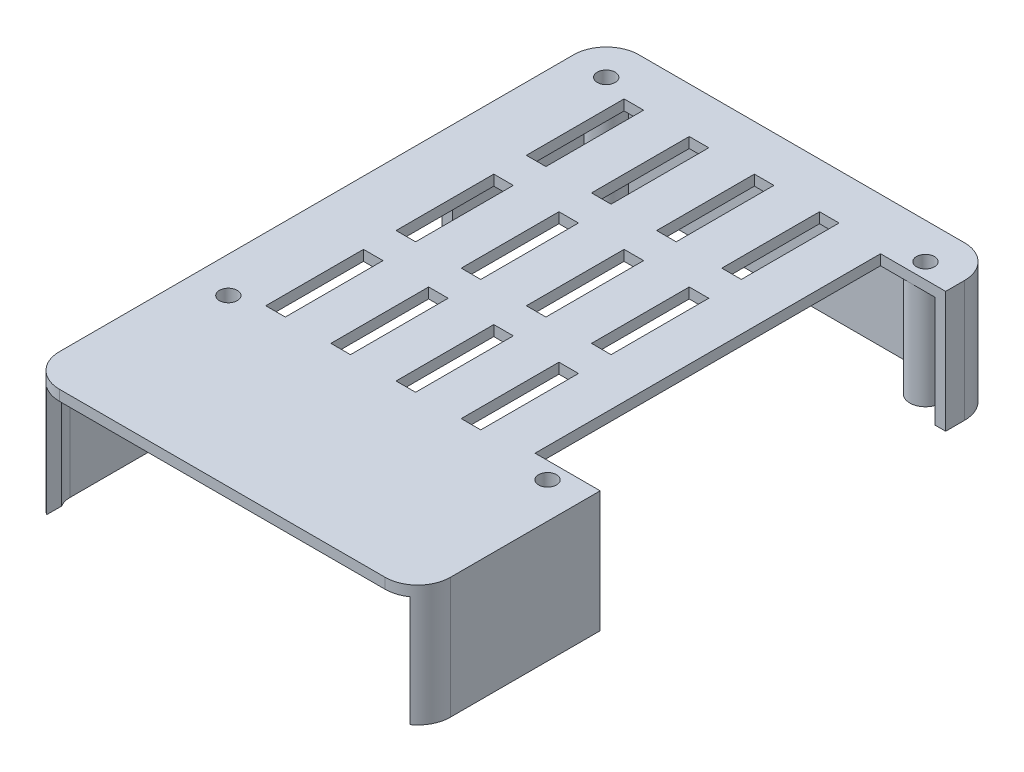
from build123d import *

# Parameters (mm, degrees)
SKETCH1_R           = 1.375
BOSS_EXTRUDE1_DEPTH = 1.6
BOSS_EXTRUDE2_START = -17
BOSS_EXTRUDE2_DEPTH = 17
BOSS_EXTRUDE3_START = -17.6
SKETCH2_R           = 2.4
SKETCH2_R_2         = 1.375
BOSS_EXTRUDE3_DEPTH = 17.6
SKETCH3_W           = 36.288172123
SKETCH3_H           = 9.00941151
CUT_EXTRUDE1_DEPTH  = 10
SKETCH5_W           = 16.770268593
SKETCH5_H           = 4.911067329
CUT_EXTRUDE2_DEPTH  = 10
SKETCH7_W           = 55
SKETCH7_H           = 17
CUT_EXTRUDE3_DEPTH  = 10
SKETCH9_W           = 3
SKETCH9_H           = 15
CUT_EXTRUDE4_DEPTH  = 10
MOVE_FACE1_BY       = 0.4
MOVE_FACE1_2_BY     = 0.4
MOVE_FACE1_3_BY     = 0.4
MOVE_FACE1_4_BY     = 0.4
MOVE_FACE1_5_BY     = 0.4
MOVE_FACE1_6_BY     = 0.4
MOVE_FACE1_7_BY     = 0.4
MOVE_FACE1_8_BY     = 0.4
MOVE_FACE1_9_BY     = 0.4
MOVE_FACE1_10_BY    = 0.4


with BuildPart() as part:
    # Sketch1 → Boss-Extrude1 (new body)
    with BuildSketch(Plane(origin=(0, 0, 0), x_dir=(1, 0, 0), z_dir=(0, 1, 0))):
        with BuildLine():
            Line((43.875879735, -16.202520779), (33.875879735, -16.202520779))
            Line((33.875879735, -16.202520779), (33.875879735, 36.821646567))
            Line((33.875879735, 36.821646567), (43.875879735, 36.821646567))
            Line((43.875879735, 36.821646567), (43.875879735, 39.72781091))
            ThreePointArc((43.875879735, 39.72781091), (42.411413641, 43.263344816), (38.875879735, 44.72781091))
            Line((38.875879735, 44.72781091), (-11.124120265, 44.72781091))
            ThreePointArc((-11.124120265, 44.72781091), (-14.65965417, 43.263344816), (-16.124120265, 39.72781091))
            Line((-16.124120265, 39.72781091), (-16.124120265, -39.202520779))
            ThreePointArc((-16.124120265, -39.202520779), (-14.65965417, -42.738054685), (-11.124120265, -44.202520779))
            Line((-11.124120265, -44.202520779), (38.875879735, -44.202520779))
            ThreePointArc((38.875879735, -44.202520779), (42.411413641, -42.738054685), (43.875879735, -39.202520779))
            Line((43.875879735, -39.202520779), (43.875879735, -16.202520779))
        make_face()
        with Locations((-10.624120265, 39.221646567)):
            Circle(SKETCH1_R, mode=Mode.SUBTRACT)
        with Locations((38.375879735, 39.221646567)):
            Circle(SKETCH1_R, mode=Mode.SUBTRACT)
        with Locations((-10.624120265, -18.778353433)):
            Circle(SKETCH1_R, mode=Mode.SUBTRACT)
        with Locations((38.375879735, -18.778353433)):
            Circle(SKETCH1_R, mode=Mode.SUBTRACT)
    extrude(amount=BOSS_EXTRUDE1_DEPTH)

    # Sketch1<3> → Boss-Extrude2 (add)
    with BuildSketch(Plane(origin=(0, 0, 0), x_dir=(1, 0, 0), z_dir=(0, 1, 0)).offset(BOSS_EXTRUDE2_START)):
        with BuildLine():
            ThreePointArc((41.875879735, -39.202520779), (40.997200079, -41.323841123), (38.875879735, -42.202520779))
            Line((38.875879735, -42.202520779), (-11.124120265, -42.202520779))
            ThreePointArc((-11.124120265, -42.202520779), (-13.245440608, -41.323841123), (-14.124120265, -39.202520779))
            Line((-14.124120265, -39.202520779), (-14.124120265, 39.72781091))
            ThreePointArc((-14.124120265, 39.72781091), (-13.245440608, 41.849131254), (-11.124120265, 42.72781091))
            Line((-11.124120265, 42.72781091), (38.875879735, 42.72781091))
            ThreePointArc((38.875879735, 42.72781091), (40.997200079, 41.849131254), (41.875879735, 39.72781091))
            Line((41.875879735, 39.72781091), (41.875879735, 36.821646567))
            Line((41.875879735, 36.821646567), (43.875879735, 36.821646567))
            Line((43.875879735, 36.821646567), (43.875879735, 39.72781091))
            ThreePointArc((43.875879735, 39.72781091), (42.411413641, 43.263344816), (38.875879735, 44.72781091))
            Line((38.875879735, 44.72781091), (-11.124120265, 44.72781091))
            ThreePointArc((-11.124120265, 44.72781091), (-14.65965417, 43.263344816), (-16.124120265, 39.72781091))
            Line((-16.124120265, 39.72781091), (-16.124120265, -39.202520779))
            ThreePointArc((-16.124120265, -39.202520779), (-14.65965417, -42.738054685), (-11.124120265, -44.202520779))
            Line((-11.124120265, -44.202520779), (38.875879735, -44.202520779))
            ThreePointArc((38.875879735, -44.202520779), (42.411413641, -42.738054685), (43.875879735, -39.202520779))
            Line((43.875879735, -39.202520779), (43.875879735, -16.202520779))
            Line((43.875879735, -16.202520779), (41.875879735, -16.202520779))
            Line((41.875879735, -16.202520779), (41.875879735, -39.202520779))
        make_face()
    extrude(amount=BOSS_EXTRUDE2_DEPTH)

    # Sketch2 → Boss-Extrude3 (add)
    # profile 1 of 4: a face of its own
    with BuildSketch(Plane(origin=(0, 1.6, 0), x_dir=(1, 0, 0), z_dir=(0, 1, 0)).offset(BOSS_EXTRUDE3_START)):
        with Locations((38.375879735, 39.221646567)):
            Circle(SKETCH2_R)
        with Locations((38.375879735, 39.221646567)):
            Circle(SKETCH2_R_2, mode=Mode.SUBTRACT)
    # profile 2 of 4: a face of its own
    with BuildSketch(Plane(origin=(0, 1.6, 0), x_dir=(1, 0, 0), z_dir=(0, 1, 0)).offset(BOSS_EXTRUDE3_START)):
        with Locations((38.375879735, -18.778353433)):
            Circle(SKETCH2_R)
        with Locations((38.375879735, -18.778353433)):
            Circle(SKETCH2_R_2, mode=Mode.SUBTRACT)
    # profile 3 of 4: a face of its own
    with BuildSketch(Plane(origin=(0, 1.6, 0), x_dir=(1, 0, 0), z_dir=(0, 1, 0)).offset(BOSS_EXTRUDE3_START)):
        with Locations((-10.624120265, -18.778353433)):
            Circle(SKETCH2_R)
        with Locations((-10.624120265, -18.778353433)):
            Circle(SKETCH2_R_2, mode=Mode.SUBTRACT)
    # profile 4 of 4: a face of its own
    with BuildSketch(Plane(origin=(0, 1.6, 0), x_dir=(1, 0, 0), z_dir=(0, 1, 0)).offset(BOSS_EXTRUDE3_START)):
        with Locations((-10.624120265, 39.221646567)):
            Circle(SKETCH2_R)
        with Locations((-10.624120265, 39.221646567)):
            Circle(SKETCH2_R_2, mode=Mode.SUBTRACT)
    extrude(amount=BOSS_EXTRUDE3_DEPTH)

    # Sketch3 → Cut-Extrude1 (cut)
    with BuildSketch(Plane(origin=(-14.124120265, 0, 0), x_dir=(0, 0, -1), z_dir=(1, 0, 0))):
        with Locations((1.373104953, -12.495294245)):
            Rectangle(SKETCH3_W, SKETCH3_H)
    extrude(amount=-CUT_EXTRUDE1_DEPTH, mode=Mode.SUBTRACT)

    # Sketch5 → Cut-Extrude2 (cut)
    with BuildSketch(Plane.ZY.offset(16.124120265)):
        with Locations((-27.902325311, -14.544466336)):
            Rectangle(SKETCH5_W, SKETCH5_H)
    extrude(amount=-CUT_EXTRUDE2_DEPTH, mode=Mode.SUBTRACT)

    # Sketch7 → Cut-Extrude3 (cut)
    with BuildSketch(Plane.XY.offset(44.202520779)):
        with Locations((13.875879735, -8.5)):
            Rectangle(SKETCH7_W, SKETCH7_H)
    extrude(amount=-CUT_EXTRUDE3_DEPTH, mode=Mode.SUBTRACT)

    # Sketch9 → Cut-Extrude4 (cut)
    with BuildSketch(Plane(origin=(0, 1.6, 0), x_dir=(1, 0, 0), z_dir=(0, 1, 0))):
        with Locations((-4.888394882, 30.22781091)):
            Rectangle(SKETCH9_W, SKETCH9_H)
        with Locations((5.111605118, 30.22781091)):
            Rectangle(SKETCH9_W, SKETCH9_H)
        with Locations((15.111605118, 30.22781091)):
            Rectangle(SKETCH9_W, SKETCH9_H)
        with Locations((25.111605118, 30.22781091)):
            Rectangle(SKETCH9_W, SKETCH9_H)
        with Locations((5.111605118, 10.22781091)):
            Rectangle(SKETCH9_W, SKETCH9_H)
        with Locations((15.111605118, 10.22781091)):
            Rectangle(SKETCH9_W, SKETCH9_H)
        with Locations((25.111605118, 10.22781091)):
            Rectangle(SKETCH9_W, SKETCH9_H)
        with Locations((5.111605118, -9.77218909)):
            Rectangle(SKETCH9_W, SKETCH9_H)
        with Locations((15.111605118, -9.77218909)):
            Rectangle(SKETCH9_W, SKETCH9_H)
        with Locations((25.111605118, -9.77218909)):
            Rectangle(SKETCH9_W, SKETCH9_H)
        with Locations((-4.888394882, 10.22781091)):
            Rectangle(SKETCH9_W, SKETCH9_H)
        with Locations((-4.888394882, -9.77218909)):
            Rectangle(SKETCH9_W, SKETCH9_H)
    extrude(amount=-CUT_EXTRUDE4_DEPTH, mode=Mode.SUBTRACT)

    # Move Face1: a face moved inward by 0.4
    extrude(part.faces().sort_by_distance((41.375879735, -8.5, 42.196740487))[0], amount=MOVE_FACE1_BY, dir=(1, 0, 0), mode=Mode.SUBTRACT)

    # Move Face1 2: a curved face moved inward by 0.4
    add(Solid.thicken(part.faces().sort_by_distance((41.748161059, -8.5, 40.068546183))[0], -MOVE_FACE1_2_BY), mode=Mode.SUBTRACT)

    # Move Face1 3: a face moved inward by 0.4
    extrude(part.faces().sort_by_distance((41.875879735, -8.5, 27.702520779))[0], amount=MOVE_FACE1_3_BY, dir=(1, 0, 0), mode=Mode.SUBTRACT)

    # Move Face1 4: a face moved inward by 0.4
    extrude(part.faces().sort_by_distance((-13.624120265, -8.5, 42.196740487))[0], amount=MOVE_FACE1_4_BY, dir=(-1, 0, 0), mode=Mode.SUBTRACT)

    # Move Face1 5: a curved face moved inward by 0.4
    add(Solid.thicken(part.faces().sort_by_distance((-13.996401588, -8.5, 40.068546183))[0], -MOVE_FACE1_5_BY), mode=Mode.SUBTRACT)

    # Move Face1 6: a face moved inward by 0.4
    extrude(part.faces().sort_by_distance((-14.124120265, -6.565433094, 2.567801751))[0], amount=MOVE_FACE1_6_BY, dir=(-1, 0, 0), mode=Mode.SUBTRACT)

    # Move Face1 7: a curved face moved inward by 0.4
    add(Solid.thicken(part.faces().sort_by_distance((-13.245440608, -8.5, -41.849131254))[0], -MOVE_FACE1_7_BY), mode=Mode.SUBTRACT)

    # Move Face1 8: a face moved inward by 0.4
    extrude(part.faces().sort_by_distance((41.875879735, -8.5, -38.274728738))[0], amount=MOVE_FACE1_8_BY, dir=(1, 0, 0), mode=Mode.SUBTRACT)

    # Move Face1 9: a curved face moved inward by 0.4
    add(Solid.thicken(part.faces().sort_by_distance((40.997200079, -8.5, -41.849131254))[0], -MOVE_FACE1_9_BY), mode=Mode.SUBTRACT)

    # Move Face1 10: a face moved inward by 0.4
    extrude(part.faces().sort_by_distance((13.875879735, -8.5, -42.72781091))[0], amount=MOVE_FACE1_10_BY, dir=(0, 0, -1), mode=Mode.SUBTRACT)


solid = part.part
